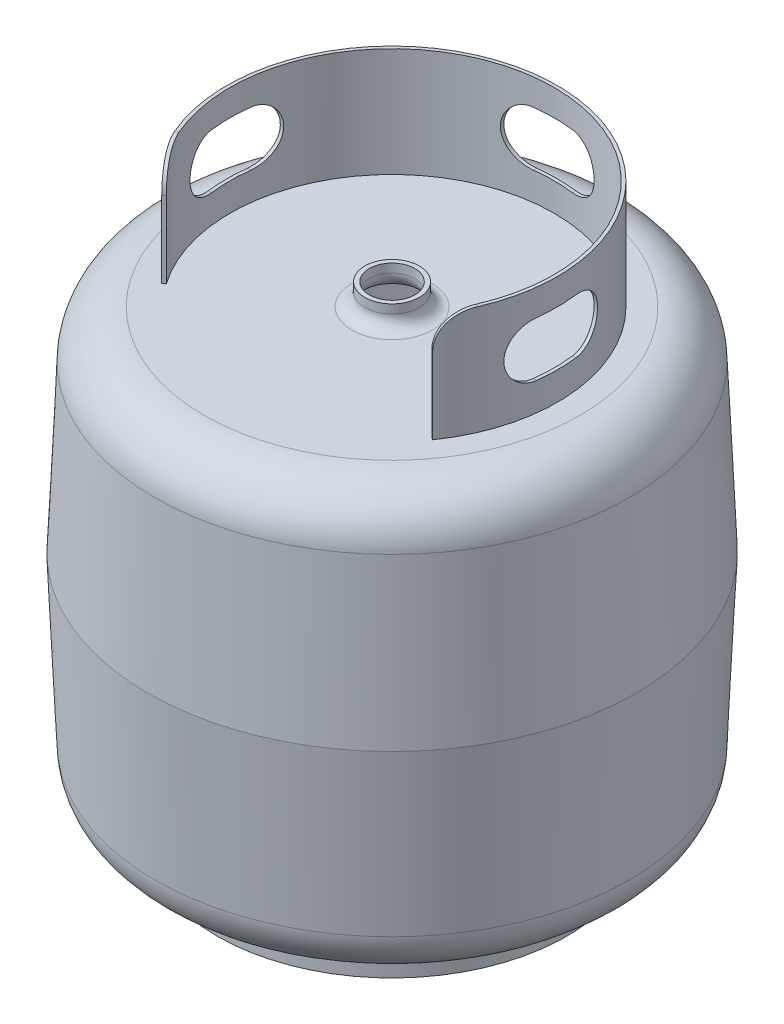
from build123d import *

# Parameters (mm, degrees)
BOSS_EXTRU_1_DEPTH             = 100
ENL_V_MAT_EXTRU_2_DEPTH        = 300
R_P_TITION_START               = -153
R_P_TITION_CIRCULAIRE2_DEPTH   = 154.778817269
R_P_TITION_CIRCULAIRE2_2_DEPTH = 177.083472837
CONG_1_R                       = 30
ESQUISSE5_R                    = 160.542830029
ESQUISSE5_R_2                  = 148.792830029
BOSS_EXTRU_2_DEPTH             = 30


with BuildPart() as part:
    # Esquisse1 → Révolution1 (revolve)
    with BuildSketch(Plane.XY, mode=Mode.PRIVATE) as r_volution1_sk:
        with BuildLine():
            Line((25, 268.966851055), (25, 260.966851055))
            ThreePointArc((25, 260.966851055), (28.514718626, 252.481569681), (37, 248.966851055))
            Line((37, 248.966851055), (172.542830029, 248.966851055))
            ThreePointArc((172.542830029, 248.966851055), (203.660917539, 236.473229348), (217.5, 205.929723487))
            Line((217.5, 205.929723487), (224.134842297, 53.966851055))
            Line((224.134842297, 53.966851055), (217.5, -97.996021376))
            ThreePointArc((217.5, -97.996021376), (203.660917539, -128.539527238), (172.542830029, -141.033148945))
            Line((172.542830029, -141.033148945), (0, -141.033148945))
            Line((0, -141.033148945), (0, -136.983148945))
            Line((0, -136.983148945), (172.542830029, -136.983148945))
            ThreePointArc((172.542830029, -136.983148945), (200.860289663, -125.613953191), (213.453854703, -97.819362857))
            Line((213.453854703, -97.819362857), (220.080983923, 53.966851055))
            Line((220.080983923, 53.966851055), (213.453854703, 205.753064968))
            ThreePointArc((213.453854703, 205.753064968), (200.860289663, 233.547655301), (172.542830029, 244.916851055))
            Line((172.542830029, 244.916851055), (37, 244.916851055))
            ThreePointArc((37, 244.916851055), (25.650936162, 249.617787217), (20.95, 260.966851055))
            Line((20.95, 260.966851055), (20.95, 268.966851055))
            Line((20.95, 268.966851055), (25, 268.966851055))
        make_face()
    revolve(r_volution1_sk.sketch.rotate(Axis((0, 279.113826924, 0), (0, -1, 0)), 90), axis=Axis((0, 279.113826924, 0), (0, -1, 0)))

    # Esquisse2 → Boss.-Extru.1 (add)
    with BuildSketch(Plane(origin=(0, 248.966851055, 0), x_dir=(1, 0, 0), z_dir=(0, 1, 0))):
        with BuildLine():
            Line((124.339088803, -87.063167274), (121.88163267, -85.342437965))
            ThreePointArc((121.88163267, -85.342437965), (0, 148.79), (-121.88163267, -85.342437965))
            Line((-121.88163267, -85.342437965), (-124.339088803, -87.063167274))
            ThreePointArc((-124.339088803, -87.063167274), (0, 151.79), (124.339088803, -87.063167274))
        make_face()
    extrude(amount=BOSS_EXTRU_1_DEPTH)

    # Esquisse3 → Enlèv. mat.-Extru.2 (cut)
    with BuildSketch(Plane(origin=(0, 0, 0), x_dir=(0, 0, -1), z_dir=(1, 0, 0))):
        with BuildLine():
            Line((18, 274.818022329), (-18, 274.818022329))
            ThreePointArc((-18, 274.818022329), (-43, 299.818022329), (-18, 324.818022329))
            Line((-18, 324.818022329), (18, 324.818022329))
            ThreePointArc((18, 324.818022329), (43, 299.818022329), (18, 274.818022329))
        make_face()
    extrude(amount=ENL_V_MAT_EXTRU_2_DEPTH, mode=Mode.SUBTRACT)

    # Répétition circulaire2: read off the stored shape, not the designer's step
    # Répétition circulaire2 outline → Répétition circulaire2 (cut)
    with BuildSketch(Plane.YZ.offset(R_P_TITION_START)):
        with BuildLine():
            Line((274.818022329, 17.999999819), (274.818022329, -17.999999888))
            ThreePointArc((274.818022329, -17.999999888), (299.818022322, -43), (324.818022329, -17.999999902))
            Line((324.818022329, -17.999999902), (324.818022329, 17.999999814))
            ThreePointArc((324.818022329, 17.999999814), (299.818022332, 43), (274.818022329, 17.999999819))
        make_face()
    extrude(amount=R_P_TITION_CIRCULAIRE2_DEPTH, mode=Mode.SUBTRACT)

    # R_p_tition circulaire2 2 outline → R_p_tition circulaire2 2 (cut)
    with BuildSketch(Plane.XY.offset(R_P_TITION_START)):
        with BuildLine():
            Line((18, 324.818022329), (-17.999999779, 324.818022329))
            ThreePointArc((-17.999999779, 324.818022329), (-43, 299.818022385), (-17.999999891, 274.818022329))
            Line((-17.999999891, 274.818022329), (18, 274.818022329))
            ThreePointArc((18, 274.818022329), (43, 299.818022329), (18, 324.818022329))
        make_face()
    extrude(amount=R_P_TITION_CIRCULAIRE2_2_DEPTH, mode=Mode.SUBTRACT)

    # Congé1
    cong_1_edges = [part.edges().sort_by_distance(p)[0] for p in [
        (123.110360736, 348.966851055, 86.202802619),
        (-123.110360736, 348.966851055, 86.202802619),
    ]]
    fillet(cong_1_edges, radius=CONG_1_R)

    # Esquisse5 → Boss.-Extru.2 (add)
    with BuildSketch(Plane.XZ.offset(141.033148945)):
        with Locations(Location((0, 0, 0), (0, 0, 90))):
            Circle(ESQUISSE5_R)
        with Locations(Location((0, 0, 0), (0, 0, 270))):
            Circle(ESQUISSE5_R_2, mode=Mode.SUBTRACT)
    extrude(amount=BOSS_EXTRU_2_DEPTH)


solid = part.part
